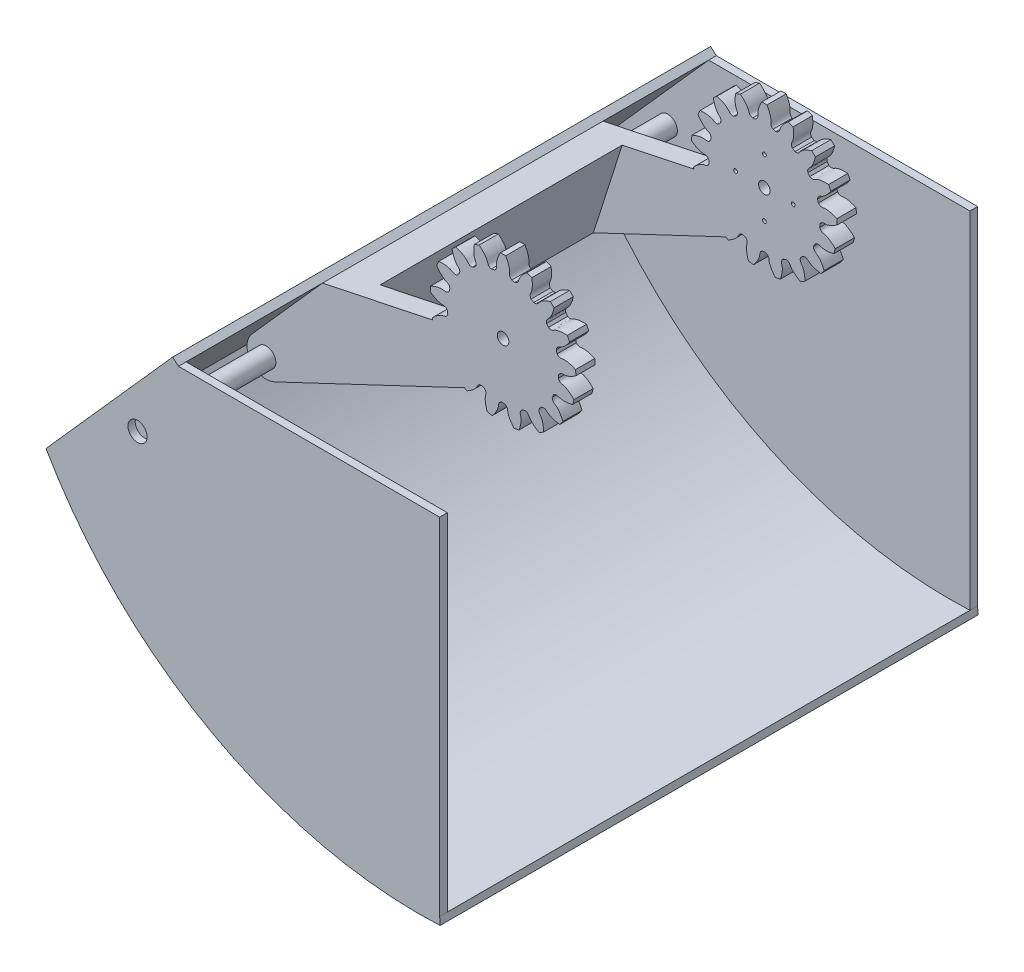
from build123d import *

# Parameters (mm, degrees)
SKETCH_1_R                     = 19
EXTRUDE_1_DEPTH                = 5
CUT_EXTRUDE_1_DEPTH            = 28.331300737
PATTERN_CIRCULAR_1_COUNT       = 17
CUT_EXTRUDE_2_REACH            = 29.31
SKETCH_4_R                     = 1.5
EXTRUDE_START                  = -5
EXTRUDE_2_DEPTH                = 5
FILLET_1_R                     = 5
EXTRUDE_3_DEPTH                = 31.5
EXTRUDE_3_DEPTH_BACK           = 36.5
SKETCH_6_R                     = 2.5
EXTRUDE_6_REACH                = 128.253
EXTRUDE_4_DEPTH                = 2
EXTRUDE_1_2_REACH              = 195.753
SKETCH_13_R                    = 2.5
CUT_EXTRUDE_3_DEPTH            = 10
SKETCH_14_R                    = 2.5
CUT_EXTRUDE_5_DEPTH            = 1.9
CUT_EXTRUDE_START              = -1.9
SKETCH_16_R                    = 2.5
CUT_EXTRUDE_7_DEPTH            = 1.9
SPLIT_BODIES_1_SURFACE_1_BACK  = 216.435
SPLIT_BODIES_1_SURFACE_1_DEPTH = 432.87
SPLIT_BODIES_1_SURFACE_2_BACK  = 216.435
SPLIT_BODIES_1_SURFACE_2_DEPTH = 432.87
SKETCH_18_R                    = 0.5
CUT_EXTRUDE_8_DEPTH            = 5


with BuildPart() as part:
    # 草图1 → Extrude 1 (new body)
    with BuildSketch(Plane.XY):
        Circle(SKETCH_1_R)
    extrude(amount=EXTRUDE_1_DEPTH)

    # 草图2 → 切除-拉伸1 (cut, through all)
    with BuildSketch(Plane.XY):
        with BuildLine():
            ThreePointArc((-2.266758905, 14.321724898), (-2.664309476, 14.253120887), (-3.059797624, 14.17348364))
            add(Edge.make_bspline(
                [(-3.059797624, 14.17348364), (-3.962933725, 14.366071709), (-3.962934346, 15.037485962), (-4.218625423, 15.620450993), (-4.241413284, 15.669756218), (-4.267980936, 15.724341344), (-4.298541242, 15.7840751), (-4.333311574, 15.848816568), (-4.372502628, 15.918419242), (-4.416321676, 15.992729901), (-4.464971347, 16.071589098), (-4.518649771, 16.154831162), (-4.577550319, 16.242284354), (-4.641861471, 16.333770978), (-4.711766641, 16.429107513), (-4.787444027, 16.528104744), (-4.869066458, 16.630567903), (-4.956801238, 16.7362968), (-5.050810004, 16.845085974), (-5.151248582, 16.95672484), (-5.258266842, 17.070997835), (-5.372008572, 17.187684578), (-5.492611337, 17.306560025), (-5.620206353, 17.427394631), (-5.754918366, 17.549954517), (-5.896865529, 17.674001633), (-6.046159285, 17.799293931), (-6.202904258, 17.925585543), (-6.367198142, 18.052626951), (-6.539131602, 18.180165169), (-6.718788171, 18.307943926), (-6.906244159, 18.435703851), (-7.101568561, 18.563182658), (-7.304822972, 18.690115336), (-7.516061508, 18.816234341), (-7.735330729, 18.941269791), (-7.962669568, 19.06494966), (-8.198109265, 19.186999974), (-8.441673306, 19.307145015), (-8.693377364, 19.425107518), (-8.953229259, 19.540608875), (-9.221228861, 19.653369347), (-9.593373706, 19.801261158), (-9.8787636, 19.904775378), (-10.072313989, 19.970720454)],
                knots=[0, 0, 0, 0, 0.193882922, 0.199023975, 0.204850501, 0.211362501, 0.218559975, 0.226442923, 0.235011345, 0.24426524, 0.254204608, 0.264829451, 0.276139767, 0.288135557, 0.300816821, 0.314183558, 0.328235769, 0.342973453, 0.358396612, 0.374505244, 0.39129935, 0.408778929, 0.426943982, 0.445794509, 0.46533051, 0.485551984, 0.506458932, 0.528051354, 0.550329249, 0.573292619, 0.596941461, 0.621275778, 0.646295568, 0.672000832, 0.69839157, 0.725467781, 0.753229466, 0.781676625, 0.810809257, 0.840627364, 0.871130943, 0.902319997, 0.934194524, 1, 1, 1, 1], degree=3))
            ThreePointArc((-10.072313989, 19.970720454), (-4.109828996, 21.98614314), (2.178079583, 22.260663824))
            add(Edge.make_bspline(
                [(-2.266758905, 14.321724898), (-1.494176252, 14.827551969), (-1.736713334, 15.453629331), (-1.708874541, 16.089594074), (-1.70543615, 16.143801725), (-1.700380478, 16.20429814), (-1.693461614, 16.271037807), (-1.684425961, 16.343967847), (-1.673024129, 16.423027755), (-1.65900749, 16.508149532), (-1.642129503, 16.599257693), (-1.622145569, 16.696269325), (-1.598813335, 16.799094139), (-1.571892861, 16.907634521), (-1.541146823, 17.0217856), (-1.506340704, 17.141435309), (-1.467242989, 17.26646446), (-1.423625355, 17.39674682), (-1.375262862, 17.532149191), (-1.321934135, 17.672531493), (-1.263421553, 17.817746862), (-1.199511431, 17.967641737), (-1.129994199, 18.122055962), (-1.05466458, 18.280822895), (-0.973321768, 18.443769509), (-0.885769596, 18.61071651), (-0.791816711, 18.781478452), (-0.691276737, 18.955863862), (-0.583968442, 19.133675362), (-0.469715896, 19.3147098), (-0.348348634, 19.498758384), (-0.219701805, 19.685606823), (-0.083616325, 19.875035465), (0.060060972, 20.066819444), (0.211477194, 20.260728831), (0.370773247, 20.456528787), (0.538083701, 20.653979716), (0.713536655, 20.852837432), (0.897253607, 21.052853317), (1.089349329, 21.253774491), (1.289931758, 21.455343982), (1.499101823, 21.657300896), (1.792694109, 21.929637716), (2.02142025, 22.129254693), (2.178079583, 22.260663824)],
                knots=[0, 0, 0, 0, 0.193882922, 0.199023975, 0.204850501, 0.211362501, 0.218559975, 0.226442923, 0.235011345, 0.24426524, 0.254204608, 0.264829451, 0.276139767, 0.288135557, 0.300816821, 0.314183558, 0.328235769, 0.342973453, 0.358396612, 0.374505244, 0.39129935, 0.408778929, 0.426943982, 0.445794509, 0.46533051, 0.485551984, 0.506458932, 0.528051354, 0.550329249, 0.573292619, 0.596941461, 0.621275778, 0.646295568, 0.672000832, 0.69839157, 0.725467781, 0.753229466, 0.781676625, 0.810809257, 0.840627364, 0.871130943, 0.902319997, 0.934194524, 1, 1, 1, 1], degree=3))
        make_face()
    cut_extrude_1 = extrude(amount=CUT_EXTRUDE_1_DEPTH, mode=Mode.SUBTRACT)

    # 阵列(圆周)1: 切除-拉伸1 ×17 about axis
    pattern_circular_1_axis = Axis((0, 0, -1.5), (0, 0, 1))
    for i in range(1, PATTERN_CIRCULAR_1_COUNT):
        add(cut_extrude_1.rotate(pattern_circular_1_axis, i * 360 / PATTERN_CIRCULAR_1_COUNT), mode=Mode.SUBTRACT)

    # 草图4 → 切除-拉伸2 (cut, up to next)
    with BuildSketch(Plane.XY.offset(5), mode=Mode.PRIVATE) as cut_extrude_2_sk1:
        Circle(SKETCH_4_R)
    cut_extrude_2_tool1 = extrude(cut_extrude_2_sk1.sketch, amount=-CUT_EXTRUDE_2_REACH, mode=Mode.PRIVATE) & part.part
    add(cut_extrude_2_tool1.solids().sort_by_distance((0, 0, 5))[0], mode=Mode.SUBTRACT)

    # 草图5 → 凸台-拉伸2 (add)
    with BuildSketch(Plane.XY.offset(5).offset(EXTRUDE_START)):
        with BuildLine():
            Line((-18.335462164, -4.9810468), (-47, -11))
            Line((-47, -11), (-81.662354228, -50))
            Line((-81.662354228, -50), (-10.056781775, -16.120209066))
            ThreePointArc((-10.056781775, -16.120209066), (-10.313158221, -15.957404786), (-10.566899695, -15.790523451))
            add(Edge.make_bspline(
                [(-9.466744087, -10.983203376), (-9.076171588, -11.819981784), (-9.611971354, -12.224599764), (-9.932989647, -12.797614952), (-9.96836878, -12.8656606), (-10.005514008, -12.942340321), (-10.036225008, -13.009103097), (-10.08049607, -13.110634994), (-10.13780769, -13.254062084), (-10.206075748, -13.446849478), (-10.274172696, -13.666623931), (-10.340037554, -13.913640911), (-10.401589841, -14.188034012), (-10.456736477, -14.489813577), (-10.503378232, -14.818866031), (-10.539416325, -15.174953454), (-10.559357023, -15.501929589), (-10.565478264, -15.71009435), (-10.566899695, -15.790523451)],
                knots=[0.467653069, 0.467653069, 0.467653069, 0.467653069, 0.661535991, 0.666677044, 0.67901557, 0.686213044, 0.694095992, 0.702664414, 0.721857677, 0.743792836, 0.768469889, 0.795888838, 0.826049681, 0.858952419, 0.894597051, 0.932983579, 0.974112001, 1, 1, 1, 1], degree=3))
            ThreePointArc((-9.466744087, -10.983203376), (-9.768630838, -10.715589183), (-10.062955765, -10.439680133))
            add(Edge.make_bspline(
                [(-14.748271747, -11.978667725), (-14.603745843, -11.962696254), (-14.337048962, -11.927494191), (-13.958761179, -11.861280755), (-13.621453113, -11.788247241), (-13.312080223, -11.708206349), (-13.030623683, -11.62326523), (-12.776941353, -11.535516668), (-12.583504365, -11.459839579), (-12.412103857, -11.386627592), (-12.28832564, -11.329452363), (-12.174012341, -11.272299248), (-12.097636785, -11.232187436), (-12.027674477, -11.193642056), (-11.964029852, -11.156902494), (-11.891104199, -11.112841208), (-11.826612856, -11.071335066), (-11.285658822, -10.698819452), (-10.932199548, -10.127974778), (-10.062955765, -10.439680133)],
                knots=[0, 0, 0, 0, 0.046794947, 0.086552422, 0.123568002, 0.157841687, 0.189373478, 0.218163373, 0.244211374, 0.256207164, 0.278142323, 0.288081691, 0.297335586, 0.305904008, 0.313786956, 0.32098443, 0.333322956, 0.338464009, 0.532346931, 0.532346931, 0.532346931, 0.532346931], degree=3))
            ThreePointArc((-14.748271747, -11.978667725), (-15.16237434, -11.449995825), (-15.557535517, -10.907020153))
            add(Edge.make_bspline(
                [(-12.795066651, -6.821749731), (-12.733147869, -7.743113419), (-13.378931145, -7.926855248), (-13.885268749, -8.345210815), (-13.942839732, -8.395881075), (-14.005176535, -8.453964382), (-14.057931186, -8.505124723), (-14.135890274, -8.583807845), (-14.241143609, -8.696846279), (-14.374444516, -8.851953903), (-14.517334719, -9.032288022), (-14.667984695, -9.238831365), (-14.824502715, -9.472460061), (-14.984940774, -9.733939862), (-15.147300373, -10.023923192), (-15.309538507, -10.342946364), (-15.446250058, -10.640639119), (-15.527155731, -10.83253573), (-15.557535517, -10.907020153)],
                knots=[0.467653069, 0.467653069, 0.467653069, 0.467653069, 0.661535991, 0.666677044, 0.67901557, 0.686213044, 0.694095992, 0.702664414, 0.721857677, 0.743792836, 0.768469889, 0.795888838, 0.826049681, 0.858952419, 0.894597051, 0.932983579, 0.974112001, 1, 1, 1, 1], degree=3))
            ThreePointArc((-12.795066651, -6.821749731), (-12.979894267, -6.463152855), (-13.154674242, -6.0995529))
            add(Edge.make_bspline(
                [(-18.079547724, -5.84208474), (-17.939011771, -5.879400565), (-17.677607884, -5.942917644), (-17.300945979, -6.017828763), (-16.960032827, -6.071576767), (-16.642637093, -6.108699236), (-16.349502414, -6.131167831), (-16.08125225, -6.140985361), (-15.873539913, -6.140296077), (-15.687266479, -6.133944938), (-15.551192654, -6.125344474), (-15.423952591, -6.113345508), (-15.338244448, -6.103532391), (-15.259082341, -6.092863194), (-15.186463635, -6.081595664), (-15.102545717, -6.066853523), (-15.027415583, -6.051447157), (-14.388422807, -5.89950183), (-13.852618968, -5.494889241), (-13.154674242, -6.0995529)],
                knots=[0, 0, 0, 0, 0.046794947, 0.086552422, 0.123568002, 0.157841687, 0.189373478, 0.218163373, 0.244211374, 0.256207164, 0.278142323, 0.288081691, 0.297335586, 0.305904008, 0.313786956, 0.32098443, 0.333322956, 0.338464009, 0.532346931, 0.532346931, 0.532346931, 0.532346931], degree=3))
            ThreePointArc((-18.079547724, -5.84208474), (-18.212594073, -5.413078342), (-18.335462164, -4.9810468))
        make_face()
    extrude(amount=EXTRUDE_2_DEPTH)

    # 圆角1
    fillet_1_edges = [part.edges().sort_by_distance(p)[0] for p in [
        (-81.662354228, -50, 2.5),
    ]]
    fillet(fillet_1_edges, radius=FILLET_1_R)

    # 草图6 → 凸台-拉伸3 (add, two sides: drawn at the far end of the back side and taken through both)
    with BuildSketch(Plane.XY.offset(5).offset(-EXTRUDE_3_DEPTH_BACK)):
        with Locations((-61.634691232, -34.992595651)):
            Circle(SKETCH_6_R)
    extrude(amount=EXTRUDE_3_DEPTH + EXTRUDE_3_DEPTH_BACK)

    # 镜向3: part across plane


with BuildPart() as part_1:
    add(part.part)
    add(part.part.mirror(Plane(origin=(0, 0, -31.5), x_dir=(1, 0, 0), z_dir=(0, 0, -1))))

    # 草图12 → 凸台-拉伸6 (add, up to next)
    with BuildSketch(Plane(origin=(0, 0, 0), x_dir=(-1, 0, 0), z_dir=(0, 0, -1)), mode=Mode.PRIVATE) as extrude_6_sk1:
        with BuildLine():
            Line((47, -11), (37, -8.900209229))
            Line((37, -8.900209229), (44.496251569, -32.415058706))
            Line((44.496251569, -32.415058706), (59.496251569, -39.512227915))
            ThreePointArc((59.496251569, -39.512227915), (65.635970426, -37.9908893), (65.371943017, -31.671007312))
            Line((65.371943017, -31.671007312), (47, -11))
        make_face()
    extrude_6_tool1 = extrude(extrude_6_sk1.sketch, amount=EXTRUDE_6_REACH, mode=Mode.PRIVATE) - part_1.part
    add(extrude_6_tool1.solids().sort_by_distance((-51.453937, -25.626532, 0))[0])

    # 草图7 → 凸台-拉伸4 (add)
    with BuildSketch(Plane.XY.offset(36.5)):
        with BuildLine():
            Line((-51, -15), (17, -15))
            Line((17, -15), (17, -105))
            ThreePointArc((17, -105), (-40.514011486, -91.914836085), (-83, -51))
            Line((-83, -51), (-51, -15))
        make_face()
    extrude(amount=EXTRUDE_4_DEPTH)

    # 镜向4: part across plane


with BuildPart() as part_2:
    add(part_1.part)
    add(part_1.part.mirror(Plane(origin=(0, 0, -31.5), x_dir=(1, 0, 0), z_dir=(0, 0, -1))))

    # Extrude 1 2: up to this face of the body (flat: up to its plane)
    extrude_1_2_end = Plane(part_2.part.faces().sort_by_distance((-23.782229, -56.37202135, -101.5))[0])
    # 草图8 → Extrude 1 2 (add, up to the picked face)
    with BuildSketch(Plane.XY.offset(38.5), mode=Mode.PRIVATE) as extrude_1_2_sk1:
        with BuildLine():
            Line((-51, -15), (-83, -51))
            ThreePointArc((-83, -51), (-40.514011486, -91.914836085), (17, -105))
            Line((17, -105), (17.09541147, -106.997722867))
            ThreePointArc((17.09541147, -106.997722867), (-42.105720331, -93.325579404), (-85.45640647, -50.753058634))
            Line((-85.45640647, -50.753058634), (-52.494818637, -13.671272322))
            Line((-52.494818637, -13.671272322), (-51, -15))
        make_face()
    extrude_1_2_tool1 = split(extrude(extrude_1_2_sk1.sketch, amount=-EXTRUDE_1_2_REACH, mode=Mode.PRIVATE), bisect_by=extrude_1_2_end, keep=Keep.BOTH, mode=Mode.PRIVATE)
    add(extrude_1_2_tool1.solids().sort_by(Axis((-67.93861, -33.133945, 38.5), (0, 0, -1)))[0])

    # 草图13 → 切除-拉伸3 (cut)
    with BuildSketch(Plane(origin=(-22.536197948, 20.032175954, 0), x_dir=(0, 0, 1), z_dir=(-0.7474093186836592, 0.6643638388299205, 0))):
        with Locations(Location((-56.5, -51.093695561, 0), (0, 0, 270))):
            Circle(SKETCH_13_R)
        with Locations(Location((-6.5, -51.093695561, 0), (0, 0, 270))):
            Circle(SKETCH_13_R)
    extrude(amount=-CUT_EXTRUDE_3_DEPTH, mode=Mode.SUBTRACT)

    # 草图14 → 切除-拉伸5 (cut)
    with BuildSketch(Plane.XY.offset(38.5)):
        with Locations((-61.634691232, -34.992595651)):
            Circle(SKETCH_14_R)
    extrude(amount=-CUT_EXTRUDE_5_DEPTH, mode=Mode.SUBTRACT)

    # 草图16 → 切除-拉伸7 (cut)
    with BuildSketch(Plane(origin=(0, 0, -101.5), x_dir=(-1, 0, 0), z_dir=(0, 0, -1)).offset(CUT_EXTRUDE_START)):
        with Locations(Location((61.634691232, -34.992595651, 0), (0, 0, 180))):
            Circle(SKETCH_16_R)
    extrude(amount=CUT_EXTRUDE_7_DEPTH, mode=Mode.SUBTRACT)


with BuildPart() as body_2:
    # Split Bodies 1: the piece behind the surface
    add(part_2.part)
    # Split Bodies 1 surface: a surface, the sketch's curves swept straight by 432.87 mm
    with BuildLine(Plane.XY.offset(38.5).offset(-SPLIT_BODIES_1_SURFACE_1_BACK), mode=Mode.PRIVATE) as split_bodies_1_surface_1_path:
        CenterArc((-61.634691232, -34.992595651), 2.5, 0, 360)
    split_bodies_1_surface_1 = Shell.extrude(split_bodies_1_surface_1_path.wire(), (0 * SPLIT_BODIES_1_SURFACE_1_DEPTH, 0 * SPLIT_BODIES_1_SURFACE_1_DEPTH, 1 * SPLIT_BODIES_1_SURFACE_1_DEPTH))
    split(bisect_by=split_bodies_1_surface_1, keep=Keep.BOTTOM)

    # 草图18 → 切除-拉伸8 (cut)
    with BuildSketch(Plane(origin=(0, 0, -68), x_dir=(-1, 0, 0), z_dir=(0, 0, -1))):
        with Locations((-7.5, 0)):
            Circle(SKETCH_18_R)
        with Locations((0, 7.5)):
            Circle(SKETCH_18_R)
        with Locations((7.5, 0)):
            Circle(SKETCH_18_R)
        with Locations((0, -7.5)):
            Circle(SKETCH_18_R)
    extrude(amount=-CUT_EXTRUDE_8_DEPTH, mode=Mode.SUBTRACT)


with BuildPart() as part_3:
    add(part_2.part)

    # Split Bodies 1: split by a surface, the side it looks to stays
    # Split Bodies 1 surface: a surface, the sketch's curves swept straight by 432.87 mm
    with BuildLine(Plane.XY.offset(38.5).offset(-SPLIT_BODIES_1_SURFACE_2_BACK), mode=Mode.PRIVATE) as split_bodies_1_surface_2_path:
        CenterArc((-61.634691232, -34.992595651), 2.5, 0, 360)
    split_bodies_1_surface_2 = Shell.extrude(split_bodies_1_surface_2_path.wire(), (0 * SPLIT_BODIES_1_SURFACE_2_DEPTH, 0 * SPLIT_BODIES_1_SURFACE_2_DEPTH, 1 * SPLIT_BODIES_1_SURFACE_2_DEPTH))
    split(bisect_by=split_bodies_1_surface_2, keep=Keep.TOP)


solid = Compound([body_2.part, part_3.part])
